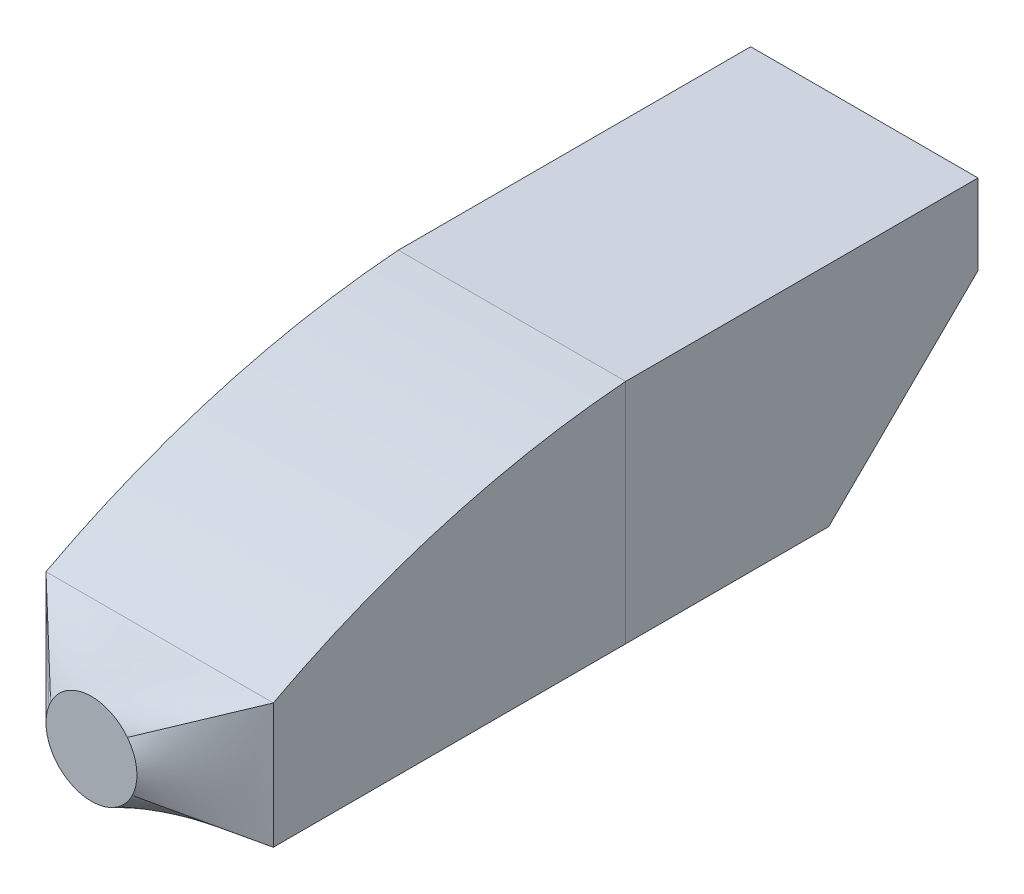
from build123d import *

# Parameters (mm, degrees)
BOSS_EXTRUDE1_DEPTH    = 100
SPLIT1_SURFACE_1_BACK  = 369.239
SPLIT1_SURFACE_1_DEPTH = 738.478
SPLIT1_SURFACE_2_BACK  = 369.239
SPLIT1_SURFACE_2_DEPTH = 738.478


with BuildPart() as part:
    # Sketch3 → Boss-Extrude1 (new body)
    with BuildSketch(Plane(origin=(0, 0, 0), x_dir=(0, 0, -1), z_dir=(1, 0, 0))):
        with BuildLine():
            Line((-155, -50), (-155, 5))
            ThreePointArc((-155, 5), (-79.813539645, 35.468858776), (0, 50))
            Line((0, 50), (155, 50))
            Line((155, 50), (155, 14.698133415))
            Line((155, 14.698133415), (89.339083264, -50))
            Line((89.339083264, -50), (-155, -50))
        make_face()
    extrude(amount=BOSS_EXTRUDE1_DEPTH)

    # Boundary1: read off the stored shape, not the designer's step
    # Boundary1: loft between two sections, ruled curve by curve
    boundary1_from = [
        Edge.make_bspline([(31.237757156, -15.573367091, 185), (30.652793203, -17.157865056, 185), (29.886284502, -20.475700825, 185), (30.021147921, -25.581876421, 185), (31.431265533, -30.491335219, 185), (33.16195132, -33.423961428, 185), (34.197201541, -34.758530126, 185)], [0, 0, 0, 0, 0.25, 0.5, 0.75, 1, 1, 1, 1], 3),
        Edge.make_bspline([(34.197201541, -34.758530126, 185), (35.232451761, -36.093098823, 185), (37.642644081, -38.498582399, 185), (42.047325798, -41.085172558, 185), (46.959588117, -42.485308309, 185), (52.06601026, -42.609319976, 185), (57.040543341, -41.449601635, 185), (61.565496183, -39.079896381, 185), (65.352228079, -35.651729054, 185), (67.222960323, -32.806427817, 185), (67.965224015, -31.289239221, 185)], [0, 0, 0, 0, 0.125, 0.25, 0.375, 0.5, 0.625, 0.75, 0.875, 1, 1, 1, 1], 3),
        Edge.make_bspline([(67.965224015, -31.289239221, 185), (68.781714077, -29.620331765, 185), (69.946725169, -26.053708986, 185), (70.154611053, -20.429336582, 185), (68.807454947, -14.964727548, 185), (66.941573702, -11.709495441, 185), (65.802798459, -10.241469874, 185)], [0, 0, 0, 0, 0.25, 0.5, 0.75, 1, 1, 1, 1], 3),
        Edge.make_bspline([(65.802798459, -10.241469874, 185), (64.767548239, -8.906901177, 185), (62.357355919, -6.501417601, 185), (57.952674202, -3.914827442, 185), (53.040411883, -2.514691691, 185), (47.93398974, -2.390680024, 185), (42.959456659, -3.550398365, 185), (38.434503817, -5.920103619, 185), (34.647771921, -9.348270946, 185), (32.777039677, -12.193572183, 185), (32.034775985, -13.710760779, 185)], [0, 0, 0, 0, 0.125, 0.25, 0.375, 0.5, 0.625, 0.75, 0.875, 1, 1, 1, 1], 3),
        Edge.make_bspline([(32.034775985, -13.710760779, 185), (31.960549615, -13.862479639, 185), (31.815940975, -14.167797893, 185), (31.610699362, -14.631123595, 185), (31.417260882, -15.099499919, 185), (31.296253551, -15.414917295, 185), (31.237757156, -15.573367091, 185)], [0, 0, 0, 0, 0.25, 0.5, 0.75, 1, 1, 1, 1], 3),
    ]
    boundary1_to = [
        Edge.make_bspline([(0, 0, 155), (0, -4.166666667, 155), (0, -12.5, 155), (0, -25, 155), (0, -37.5, 155), (0, -45.833333333, 155), (0, -50, 155)], [0, 0, 0, 0, 0.25, 0.5, 0.75, 1, 1, 1, 1], 3),
        Edge.make_bspline([(0, -50, 155), (4.166666667, -50, 155), (12.5, -50, 155), (25, -50, 155), (37.5, -50, 155), (50, -50, 155), (62.5, -50, 155), (75, -50, 155), (87.5, -50, 155), (95.833333333, -50, 155), (100, -50, 155)], [0, 0, 0, 0, 0.125, 0.25, 0.375, 0.5, 0.625, 0.75, 0.875, 1, 1, 1, 1], 3),
        Edge.make_bspline([(100, -50, 155), (100, -45.416666667, 155), (100, -36.25, 155), (100, -22.5, 155), (100, -8.75, 155), (100, 0.416666667, 155), (100, 5, 155)], [0, 0, 0, 0, 0.25, 0.5, 0.75, 1, 1, 1, 1], 3),
        Edge.make_bspline([(100, 5, 155), (95.833333333, 5, 155), (87.5, 5, 155), (75, 5, 155), (62.5, 5, 155), (50, 5, 155), (37.5, 5, 155), (25, 5, 155), (12.5, 5, 155), (4.166666667, 5, 155), (0, 5, 155)], [0, 0, 0, 0, 0.125, 0.25, 0.375, 0.5, 0.625, 0.75, 0.875, 1, 1, 1, 1], 3),
        Edge.make_bspline([(0, 5, 155), (0, 4.583333333, 155), (0, 3.75, 155), (0, 2.5, 155), (0, 1.25, 155), (0, 0.416666667, 155), (0, 0, 155)], [0, 0, 0, 0, 0.25, 0.5, 0.75, 1, 1, 1, 1], 3),
    ]
    boundary1 = Solid(Shell([*[Face.make_surface_from_curves(boundary1_from[k], boundary1_to[k]) for k in range(5)], Face(Wire(boundary1_from)), Face(Wire(boundary1_to))]))
    add(boundary1)


with BuildPart() as body_2:
    # Split1: the piece behind the surface
    add(part.part)
    # Split1 surface: a surface, the sketch's curves swept straight by 738.478 mm
    with BuildLine(Plane(origin=(100, 0, 0), x_dir=(0, 0, -1), z_dir=(1, 0, 0)).offset(-SPLIT1_SURFACE_1_BACK), mode=Mode.PRIVATE) as split1_surface_1_path:
        Line((0, 50), (0, -50))
    split1_surface_1 = Shell.extrude(split1_surface_1_path.wire(), (1 * SPLIT1_SURFACE_1_DEPTH, 0 * SPLIT1_SURFACE_1_DEPTH, 0 * SPLIT1_SURFACE_1_DEPTH))
    split(bisect_by=split1_surface_1, keep=Keep.BOTTOM)


with BuildPart() as part_1:
    add(part.part)

    # Split1: split by a surface, the side it looks to stays
    # Split1 surface: a surface, the sketch's curves swept straight by 738.478 mm
    with BuildLine(Plane(origin=(100, 0, 0), x_dir=(0, 0, -1), z_dir=(1, 0, 0)).offset(-SPLIT1_SURFACE_2_BACK), mode=Mode.PRIVATE) as split1_surface_2_path:
        Line((0, 50), (0, -50))
    split1_surface_2 = Shell.extrude(split1_surface_2_path.wire(), (1 * SPLIT1_SURFACE_2_DEPTH, 0 * SPLIT1_SURFACE_2_DEPTH, 0 * SPLIT1_SURFACE_2_DEPTH))
    split(bisect_by=split1_surface_2, keep=Keep.TOP)


solid = Compound([body_2.part, part_1.part])
